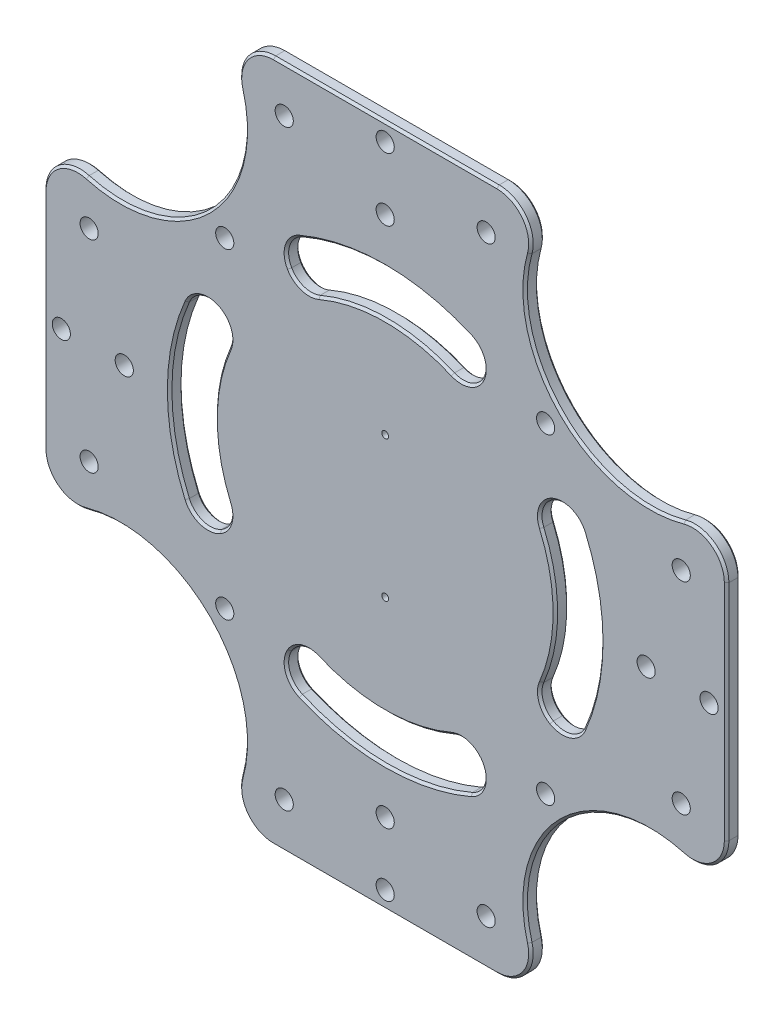
from build123d import *

# Parameters (mm, degrees)
IZIM1_R                     = 4
Y_KSEKLIK_EKSTR_ZYON1_DEPTH = 6
RADYUS1_R                   = 5
IZIM2_R                     = 4
KES_EKSTR_ZYON1_DEPTH       = 10
DAIRESEL_KAPLAMA1_COUNT     = 4
SKETCH1_W                   = 170.605519564
SKETCH1_H                   = 25.837050878
CUT_EXTRUDE1_DEPTH          = 10
CIRPATTERN1_COUNT           = 4
FILLET1_R                   = 50
CUT_EXTRUDE2_DEPTH          = 10
CUT_EXTRUDE3_DEPTH          = 10
FILLET2_R                   = 10
CIRPATTERN3_COUNT           = 4
FILLET2_OF_CIRPATTERN3_R    = 10
CIRPATTERN2_COUNT           = 4
CHAMFER1_SIZE               = 1
SKETCH4_R                   = 1.5
CUT_EXTRUDE4_DEPTH          = 10


with BuildPart() as part:
    # Çizim1 → Yükseklik-Ekstrüzyon1 (new body)
    with BuildSketch(Plane.XY):
        with BuildLine():
            Line((-150.466489, 42), (-150.466489, -42))
            Line((-150.466489, -42), (-159.565033764, -42))
            ThreePointArc((-159.565033764, -42), (-116.672618896, -116.672618896), (-42, -159.565033764))
            Line((-42, -159.565033764), (-42, -150.466489))
            Line((-42, -150.466489), (42, -150.466489))
            Line((42, -150.466489), (42, -159.565033764))
            ThreePointArc((42, -159.565033764), (116.672618896, -116.672618896), (159.565033764, -42))
            Line((159.565033764, -42), (150.466489, -42))
            Line((150.466489, -42), (150.466489, 42))
            Line((150.466489, 42), (159.565033764, 42))
            ThreePointArc((159.565033764, 42), (116.672618896, 116.672618896), (42, 159.565033764))
            Line((42, 159.565033764), (42, 150.466489))
            Line((42, 150.466489), (-42, 150.466489))
            Line((-42, 150.466489), (-42, 159.565033764))
            ThreePointArc((-42, 159.565033764), (-116.672618896, 116.672618896), (-159.565033764, 42))
            Line((-159.565033764, 42), (-150.466489, 42))
        make_face()
        with Locations((0, 115)):
            Circle(IZIM1_R, mode=Mode.SUBTRACT)
        with Locations((115, 0)):
            Circle(IZIM1_R, mode=Mode.SUBTRACT)
        with Locations((0, -115)):
            Circle(IZIM1_R, mode=Mode.SUBTRACT)
        with Locations((-115, 0)):
            Circle(IZIM1_R, mode=Mode.SUBTRACT)
        with Locations((-70.710678119, 70.710678119)):
            Circle(IZIM1_R, mode=Mode.SUBTRACT)
        with Locations((70.710678119, 70.710678119)):
            Circle(IZIM1_R, mode=Mode.SUBTRACT)
        with Locations((70.710678119, -70.710678119)):
            Circle(IZIM1_R, mode=Mode.SUBTRACT)
        with Locations((-70.710678119, -70.710678119)):
            Circle(IZIM1_R, mode=Mode.SUBTRACT)
    extrude(amount=Y_KSEKLIK_EKSTR_ZYON1_DEPTH)

    # Radyus1
    radyus1_edges = [part.edges().sort_by_distance(p)[0] for p in [
        (159.565033764, -42, 3),
        (42, -159.565033764, 3),
        (-42, -159.565033764, 3),
        (-159.565033764, -42, 3),
        (-159.565033764, 42, 3),
        (-42, 159.565033764, 3),
        (42, 159.565033764, 3),
        (159.565033764, 42, 3),
    ]]
    fillet(radyus1_edges, radius=RADYUS1_R)

    # Çizim2 → Kes-Ekstrüzyon1 (cut)
    with BuildSketch(Plane.XY.offset(6)):
        with Locations((-130.466488641, -44.496935975)):
            Circle(IZIM2_R)
        with Locations((-142.73324432, -0.000677265)):
            Circle(IZIM2_R)
        with Locations((-130.466488641, 44.495581446)):
            Circle(IZIM2_R)
    kes_ekstr_zyon1 = extrude(amount=-KES_EKSTR_ZYON1_DEPTH, mode=Mode.SUBTRACT)

    # Dairesel Kaplama1: Kes-Ekstrüzyon1 ×4 about axis
    dairesel_kaplama1_axis = Axis((0, 0, 0), (0, 0, 1))
    for i in range(1, DAIRESEL_KAPLAMA1_COUNT):
        add(kes_ekstr_zyon1.rotate(dairesel_kaplama1_axis, i * 360 / DAIRESEL_KAPLAMA1_COUNT), mode=Mode.SUBTRACT)

    # Sketch1 → Cut-Extrude1 (cut)
    with BuildSketch(Plane(origin=(0, 0, 0), x_dir=(-1, 0, 0), z_dir=(0, 0, -1))):
        with Locations((0, 163.385014439)):
            Rectangle(SKETCH1_W, SKETCH1_H)
    cut_extrude1 = extrude(amount=-CUT_EXTRUDE1_DEPTH, mode=Mode.SUBTRACT)

    # CirPattern1: Cut-Extrude1 ×4 about axis
    cirpattern1_axis = Axis((0, 0, 0), (0, 0, 1))
    for i in range(1, CIRPATTERN1_COUNT):
        add(cut_extrude1.rotate(cirpattern1_axis, i * 360 / CIRPATTERN1_COUNT), mode=Mode.SUBTRACT)

    # Fillet1
    fillet1_edges = [part.edges().sort_by_distance(p)[0] for p in [
        (67.711414754, 150.466489, 3),
        (-67.711414754, 150.466489, 3),
        (-150.466489, 67.711414754, 3),
        (-150.466489, -67.711414754, 3),
        (-67.711414754, -150.466489, 3),
        (67.711414754, -150.466489, 3),
        (150.466489, 67.711414754, 3),
        (150.466489, -67.711414754, 3),
    ]]
    fillet(fillet1_edges, radius=FILLET1_R)

    # Sketch2 → Cut-Extrude2 (cut)
    with BuildSketch(Plane(origin=(0, 0, 0), x_dir=(-1, 0, 0), z_dir=(0, 0, -1))):
        with BuildLine():
            Line((-49.24272607, 150.466489), (-49.24272607, 163.848097422))
            Line((-49.24272607, 163.848097422), (-162.900639376, 163.848097422))
            Line((-162.900639376, 163.848097422), (-162.900639376, 49.24272607))
            Line((-162.900639376, 49.24272607), (-150.466489, 49.24272607))
            ThreePointArc((-150.466489, 49.24272607), (-144.538179355, 61.188622189), (-131.439231121, 63.691988818))
            ThreePointArc((-131.439231121, 63.691988818), (-77.781745931, 77.781745931), (-63.691988818, 131.439231121))
            ThreePointArc((-63.691988818, 131.439231121), (-61.188622189, 144.538179355), (-49.24272607, 150.466489))
        make_face()
    cut_extrude2 = extrude(amount=-CUT_EXTRUDE2_DEPTH, mode=Mode.SUBTRACT)

    # Sketch3 → Cut-Extrude3 (cut)
    with BuildSketch(Plane(origin=(0, 0, 0), x_dir=(-1, 0, 0), z_dir=(0, 0, -1))):
        with BuildLine():
            Line((-64.951905284, 37.5), (-82.27241336, 47.5))
            ThreePointArc((-82.27241336, 47.5), (-95, 0), (-82.27241336, -47.5))
            Line((-82.27241336, -47.5), (-64.951905284, -37.5))
            ThreePointArc((-64.951905284, -37.5), (-75, 0), (-64.951905284, 37.5))
        make_face()
    cut_extrude3 = extrude(amount=-CUT_EXTRUDE3_DEPTH, mode=Mode.SUBTRACT)

    # Fillet2
    fillet2_edges = [part.edges().sort_by_distance(p)[0] for p in [
        (82.27241336, -47.5, 3),
        (64.951905284, -37.5, 3),
        (64.951905284, 37.5, 3),
        (82.27241336, 47.5, 3),
    ]]
    fillet(fillet2_edges, radius=FILLET2_R - 0.0001)  # a hair under: the kernel refuses the full size

    # CirPattern3: Cut-Extrude3 ×4 about axis
    cirpattern3_axis = Axis((0, 0, 0), (0, 0, 1))
    for i in range(1, CIRPATTERN3_COUNT):
        add(cut_extrude3.rotate(cirpattern3_axis, i * 360 / CIRPATTERN3_COUNT), mode=Mode.SUBTRACT)

    # Fillet2 of CirPattern3
    fillet2_of_cirpattern3_edges = [part.edges().sort_by_distance(p)[0] for p in [
        (47.5, 82.27241336, 3),
        (37.5, 64.951905284, 3),
        (-37.5, 64.951905284, 3),
        (-47.5, 82.27241336, 3),
        (-82.27241336, 47.5, 3),
        (-64.951905284, 37.5, 3),
        (-64.951905284, -37.5, 3),
        (-82.27241336, -47.5, 3),
        (-47.5, -82.27241336, 3),
        (-37.5, -64.951905284, 3),
        (37.5, -64.951905284, 3),
        (47.5, -82.27241336, 3),
    ]]
    fillet(fillet2_of_cirpattern3_edges, radius=FILLET2_OF_CIRPATTERN3_R - 0.0001)  # a hair under: the kernel refuses the full size

    # CirPattern2: Cut-Extrude2 ×4 about axis
    cirpattern2_axis = Axis((0, 0, 0), (0, 0, 1))
    for i in range(1, CIRPATTERN2_COUNT):
        add(cut_extrude2.rotate(cirpattern2_axis, i * 360 / CIRPATTERN2_COUNT), mode=Mode.SUBTRACT)

    # Chamfer1
    chamfer1_edges = [part.edges().sort_by_distance(p)[0] for p in [
        (0, 150.466489, 0),
        (0, 150.466489, 6),
        (61.188622189, 144.538179355, 6),
        (77.781745931, 77.781745931, 6),
        (144.538179355, 61.188622189, 6),
        (144.538179355, 61.188622189, 0),
        (77.781745931, 77.781745931, 0),
        (61.188622189, 144.538179355, 0),
        (95, 0, 6),
        (95, 0, 0),
        (75, 0, 6),
        (75, 0, 0),
        (81.25384104, -43.03461599, 0),
        (81.25384104, -43.03461599, 6),
        (68.610961465, -36.697482988, 0),
        (68.610961465, -36.697482988, 6),
        (68.610961465, 36.697482988, 0),
        (68.610961465, 36.697482988, 6),
        (81.25384104, 43.03461599, 0),
        (81.25384104, 43.03461599, 6),
        (0, 95, 6),
        (0, 95, 0),
        (0, 75, 6),
        (0, 75, 0),
        (43.03461599, 81.25384104, 0),
        (43.03461599, 81.25384104, 6),
        (36.697482988, 68.610961465, 0),
        (36.697482988, 68.610961465, 6),
        (-36.697482988, 68.610961465, 0),
        (-36.697482988, 68.610961465, 6),
        (-43.03461599, 81.25384104, 0),
        (-43.03461599, 81.25384104, 6),
        (-95, 0, 6),
        (-95, 0, 0),
        (-75, 0, 6),
        (-75, 0, 0),
        (-81.25384104, 43.03461599, 0),
        (-81.25384104, 43.03461599, 6),
        (-68.610961465, 36.697482988, 0),
        (-68.610961465, 36.697482988, 6),
        (-68.610961465, -36.697482988, 0),
        (-68.610961465, -36.697482988, 6),
        (-81.25384104, -43.03461599, 0),
        (-81.25384104, -43.03461599, 6),
        (0, -95, 6),
        (0, -95, 0),
        (0, -75, 6),
        (0, -75, 0),
        (-43.03461599, -81.25384104, 0),
        (-43.03461599, -81.25384104, 6),
        (-36.697482988, -68.610961465, 0),
        (-36.697482988, -68.610961465, 6),
        (36.697482988, -68.610961465, 0),
        (36.697482988, -68.610961465, 6),
        (43.03461599, -81.25384104, 0),
        (43.03461599, -81.25384104, 6),
        (150.466489, 0, 0),
        (150.466489, 0, 6),
        (0, -150.466489, 0),
        (0, -150.466489, 6),
        (-150.466489, 0, 0),
        (-150.466489, 0, 6),
        (-77.781745931, 77.781745931, 6),
        (-61.188622189, 144.538179355, 6),
        (-144.538179355, 61.188622189, 6),
        (-61.188622189, 144.538179355, 0),
        (-77.781745931, 77.781745931, 0),
        (-144.538179355, 61.188622189, 0),
        (-77.781745931, -77.781745931, 6),
        (-144.538179355, -61.188622189, 6),
        (-61.188622189, -144.538179355, 6),
        (-144.538179355, -61.188622189, 0),
        (-77.781745931, -77.781745931, 0),
        (-61.188622189, -144.538179355, 0),
        (77.781745931, -77.781745931, 6),
        (61.188622189, -144.538179355, 6),
        (144.538179355, -61.188622189, 6),
        (61.188622189, -144.538179355, 0),
        (77.781745931, -77.781745931, 0),
        (144.538179355, -61.188622189, 0),
    ]]
    chamfer(chamfer1_edges, length=CHAMFER1_SIZE)

    # Sketch4 → Cut-Extrude4 (cut)
    with BuildSketch(Plane.XY.offset(6)):
        with Locations((0, 31)):
            Circle(SKETCH4_R)
        with Locations((0, -31)):
            Circle(SKETCH4_R)
    extrude(amount=-CUT_EXTRUDE4_DEPTH, mode=Mode.SUBTRACT)


solid = part.part
